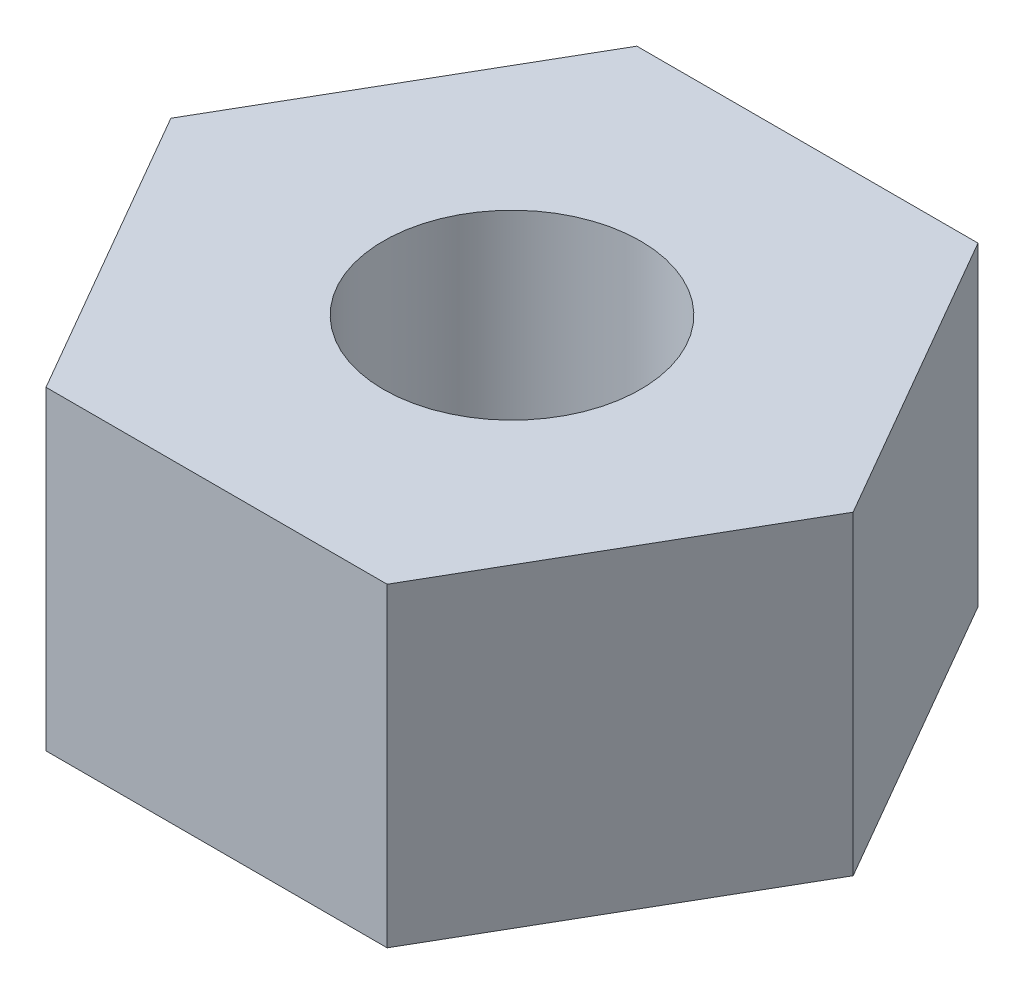
from build123d import *

# Parameters (mm, degrees)
SKETCH1_R           = 2.45
BOSS_EXTRUDE1_DEPTH = 6


with BuildPart() as part:
    # Sketch1 → Boss-Extrude1 (new body)
    with BuildSketch(Plane(origin=(0, 0, 0), x_dir=(1, 0, 0), z_dir=(0, 1, 0))):
        Polygon((3.25, -5.629165125), (6.5, 0), (3.25, 5.629165125), (-3.25, 5.629165125), (-6.5, 0), (-3.25, -5.629165125), align=None)
        Circle(SKETCH1_R, mode=Mode.SUBTRACT)
    extrude(amount=BOSS_EXTRUDE1_DEPTH)


solid = part.part
